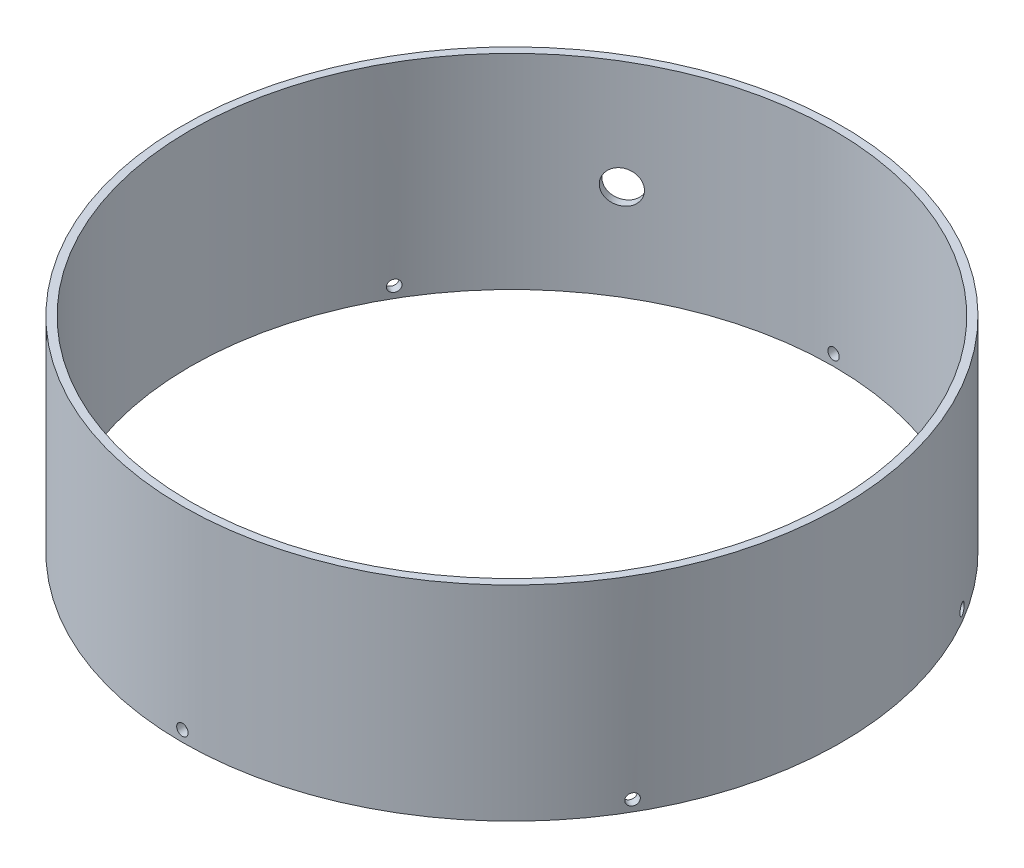
from build123d import *

# Parameters (mm, degrees)
SKETCH2_R               = 76.2
SKETCH2_R_2             = 74.3712
BOSS_EXTRUDE1_DEPTH     = 47.2948
CUT_EXTRUDE1_REACH      = 119.685
CUT_EXTRUDE1_END_RADIUS = 76.2
SKETCH3_R               = 1.3208
CIRPATTERN1_COUNT       = 6
SKETCH5_R               = 3.81
CUT_EXTRUDE2_DEPTH      = 118.684655529


with BuildPart() as part:
    # Sketch2 → Boss-Extrude1 (new body)
    with BuildSketch(Plane(origin=(0, 0, 0), x_dir=(1, 0, 0), z_dir=(0, 1, 0))):
        Circle(SKETCH2_R)
        Circle(SKETCH2_R_2, mode=Mode.SUBTRACT)
    extrude(amount=BOSS_EXTRUDE1_DEPTH)

    # Cut-Extrude1: up to this cylinder (the profile starts inside it)
    cut_extrude1_end = Plane(origin=(0, 2.54, 0), z_dir=(0, -1, 0)) * Cylinder(CUT_EXTRUDE1_END_RADIUS, 392.77, mode=Mode.PRIVATE)
    # Sketch3 → Cut-Extrude1 (cut, up to the surface)
    with BuildSketch(Plane.XY, mode=Mode.PRIVATE) as cut_extrude1_sk1:
        with Locations((0, 2.54)):
            Circle(SKETCH3_R)
    cut_extrude1_tool1 = extrude(cut_extrude1_sk1.sketch, amount=CUT_EXTRUDE1_REACH, mode=Mode.PRIVATE) & cut_extrude1_end
    cut_extrude1 = cut_extrude1_tool1.solids().sort_by_distance((0, 2.54, 0))[0]
    add(cut_extrude1, mode=Mode.SUBTRACT)

    # CirPattern1: Cut-Extrude1 ×6 about axis
    cirpattern1_axis = Axis((0, 47.2948, 0), (0, -1, 0))
    for i in range(1, CIRPATTERN1_COUNT):
        add(cut_extrude1.rotate(cirpattern1_axis, i * 360 / CIRPATTERN1_COUNT), mode=Mode.SUBTRACT)

    # Sketch5 → Cut-Extrude2 (cut, through all)
    with BuildSketch(Plane(origin=(0, 0, 0), x_dir=(-0.8571673007021099, 0, 0.5150380749100584), z_dir=(-0.5150380749100583, 0, -0.8571673007021098))):
        with Locations((0, 22.098)):
            Circle(SKETCH5_R)
    extrude(amount=CUT_EXTRUDE2_DEPTH, mode=Mode.SUBTRACT)


solid = part.part
